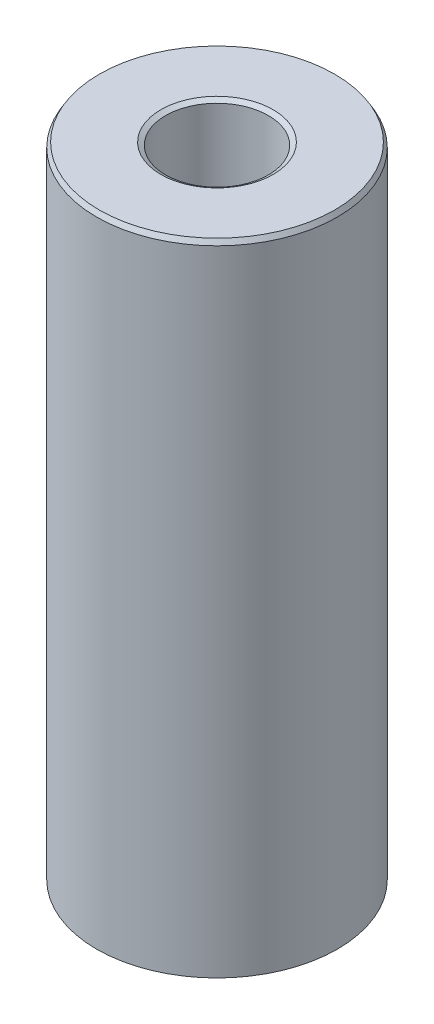
from build123d import *
from OCP.BRepFilletAPI import BRepFilletAPI_MakeChamfer

# Parameters (mm, degrees)
SKETCH1_R           = 37.5
BOSS_EXTRUDE1_DEPTH = 199.79299428
SKETCH2_R           = 16.02004891
CUT_EXTRUDE1_DEPTH  = 207.711733009
CHAMFER1_SIZE       = 1.471313818
CHAMFER1_SIZE2      = 0.849463429


with BuildPart() as part:
    # Sketch1 → Boss-Extrude1 (new body)
    with BuildSketch(Plane(origin=(0, 0, 0), x_dir=(1, 0, 0), z_dir=(0, 1, 0))):
        Circle(SKETCH1_R)
    extrude(amount=BOSS_EXTRUDE1_DEPTH)

    # Sketch2 → Cut-Extrude1 (cut, through all)
    with BuildSketch(Plane(origin=(0, 0, 0), x_dir=(1, 0, 0), z_dir=(0, 1, 0))):
        Circle(SKETCH2_R)
    extrude(amount=CUT_EXTRUDE1_DEPTH, mode=Mode.SUBTRACT)

    # Chamfer1: one chamfer whose edges measure the first distance from different faces: ONE call of the kernel's chamfer builder (chamfer() names one face for all edges)
    chamfer1_edges_1 = [part.edges().sort_by_distance(p)[0] for p in [
        (-16.02004891, 199.79299428, 0),
    ]]
    chamfer1_side_1 = [part.faces().sort_by_distance(p)[0] for p in [
        (-36.439339828, 199.79299428, 0),
    ]]
    chamfer1_edges_2 = [part.edges().sort_by_distance(p)[0] for p in [
        (-16.02004891, 0, 0),
    ]]
    chamfer1_side_2 = [part.faces().sort_by_distance(p)[0] for p in [
        (-16.02004891, 99.89649714, 0),
    ]]
    chamfer1_edges_3 = [part.edges().sort_by_distance(p)[0] for p in [
        (-37.5, 0, 0),
    ]]
    chamfer1_side_3 = [part.faces().sort_by_distance(p)[0] for p in [
        (-36.439339828, 0, 0),
    ]]
    chamfer1_edges_4 = [part.edges().sort_by_distance(p)[0] for p in [
        (-37.5, 199.79299428, 0),
    ]]
    chamfer1_side_4 = [part.faces().sort_by_distance(p)[0] for p in [
        (-37.5, 99.89649714, 0),
    ]]
    chamfer1 = BRepFilletAPI_MakeChamfer(part.part.solid().wrapped)
    for e in chamfer1_edges_1:
        chamfer1.Add(CHAMFER1_SIZE, CHAMFER1_SIZE2, e.wrapped, chamfer1_side_1[0].wrapped)  # the first distance lies on this face
    for e in chamfer1_edges_2:
        chamfer1.Add(CHAMFER1_SIZE, CHAMFER1_SIZE2, e.wrapped, chamfer1_side_2[0].wrapped)  # the first distance lies on this face
    for e in chamfer1_edges_3:
        chamfer1.Add(CHAMFER1_SIZE, CHAMFER1_SIZE2, e.wrapped, chamfer1_side_3[0].wrapped)  # the first distance lies on this face
    for e in chamfer1_edges_4:
        chamfer1.Add(CHAMFER1_SIZE, CHAMFER1_SIZE2, e.wrapped, chamfer1_side_4[0].wrapped)  # the first distance lies on this face
    add(Compound.cast(chamfer1.Shape()), mode=Mode.REPLACE)


solid = part.part
